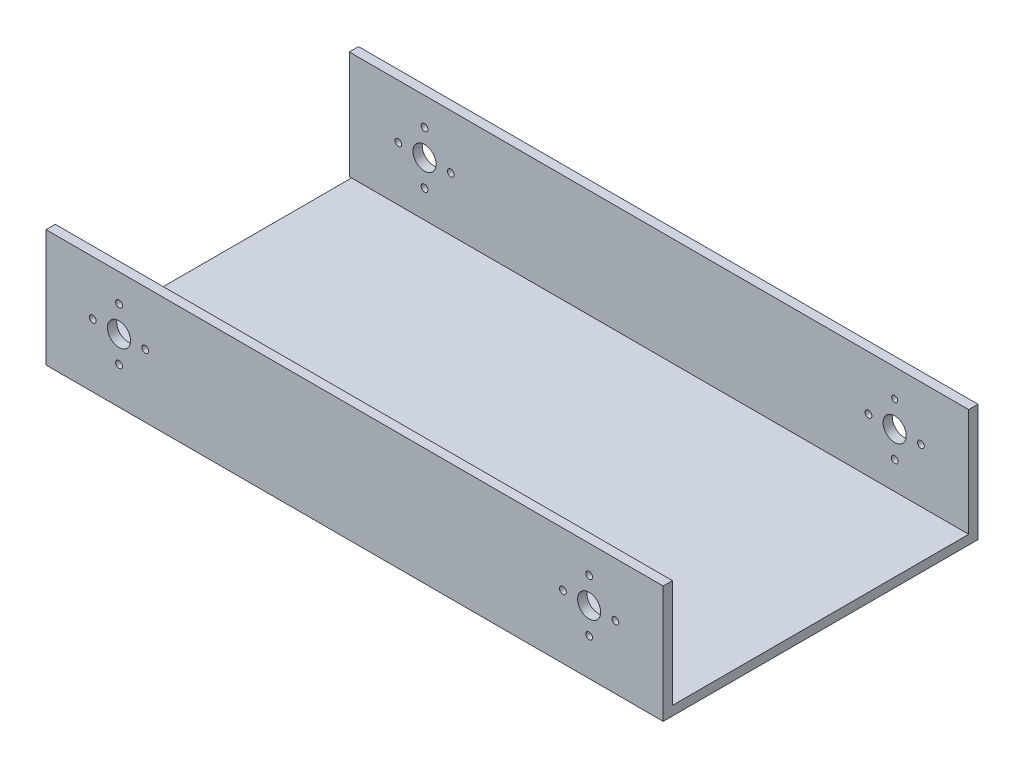
from build123d import *

# Parameters (mm, degrees)
SKETCH_1_W          = 200
SKETCH_1_H          = 35
EXTRUDE_1_DEPTH     = 3
SKETCH_2_R          = 3.75
CUT_EXTRUDE_1_DEPTH = 3
SKETCH_3_R          = 1.1
CUT_EXTRUDE_2_DEPTH = 3
SKETCH_4_W          = 200
SKETCH_4_H          = 102
EXTRUDE_2_DEPTH     = 3
SKETCH_5_W          = 200.720856775
SKETCH_5_H          = 3
EXTRUDE_3_DEPTH     = 35
CUT_EXTRUDE_START   = -35
SKETCH_6_R          = 3.75
SKETCH_6_R_2        = 1.1
SKETCH_6_R_3        = 0.981653735
CUT_EXTRUDE_3_DEPTH = 35


with BuildPart() as part:
    # 스케치1 → 보스-돌출1 (new body)
    with BuildSketch(Plane.XY):
        Rectangle(SKETCH_1_W, SKETCH_1_H)
    extrude(amount=EXTRUDE_1_DEPTH)

    # 스케치2 → 컷-돌출1 (cut)
    with BuildSketch(Plane.XY.offset(3)):
        with Locations((-76.33997629, 0)):
            Circle(SKETCH_2_R)
        with Locations((76, 0)):
            Circle(SKETCH_2_R)
    extrude(amount=-CUT_EXTRUDE_1_DEPTH, mode=Mode.SUBTRACT)

    # 스케치3 → 컷-돌출2 (cut)
    with BuildSketch(Plane.XY.offset(3)):
        with Locations((-76.33997629, 8.5)):
            Circle(SKETCH_3_R)
        with Locations((-76.33997629, -8.5)):
            Circle(SKETCH_3_R)
        with Locations((-84.83997629, 0)):
            Circle(SKETCH_3_R)
        with Locations((-67.83997629, 0)):
            Circle(SKETCH_3_R)
        with Locations((76, 8.5)):
            Circle(SKETCH_3_R)
        with Locations((76, -8.5)):
            Circle(SKETCH_3_R)
        with Locations((67.5, 0)):
            Circle(SKETCH_3_R)
        with Locations((84.5, 0)):
            Circle(SKETCH_3_R)
    extrude(amount=-CUT_EXTRUDE_2_DEPTH, mode=Mode.SUBTRACT)

    # 스케치4 → 보스-돌출2 (add)
    with BuildSketch(Plane.XZ.offset(17.5)):
        with Locations((0, -48)):
            Rectangle(SKETCH_4_W, SKETCH_4_H)
    extrude(amount=EXTRUDE_2_DEPTH)

    # 스케치5 → 보스-돌출3 (add)
    with BuildSketch(Plane(origin=(0, -17.5, 0), x_dir=(1, 0, 0), z_dir=(0, 1, 0))):
        with Locations((-0.360428388, 97.5)):
            Rectangle(SKETCH_5_W, SKETCH_5_H)
    extrude(amount=EXTRUDE_3_DEPTH)

    # 스케치6 → 컷-돌출3 (cut)
    with BuildSketch(Plane(origin=(0, 0, -99), x_dir=(-1, 0, 0), z_dir=(0, 0, -1)).offset(CUT_EXTRUDE_START)):
        with Locations((-76, 0)):
            Circle(SKETCH_6_R)
        with Locations((76.33997629, 0)):
            Circle(SKETCH_6_R)
        with Locations((-76, -8.5)):
            Circle(SKETCH_6_R_2)
        with Locations((-67.5, 0)):
            Circle(SKETCH_6_R_2)
        with Locations((-76, 8.5)):
            Circle(SKETCH_6_R_3)
        with Locations((-84.5, 0)):
            Circle(SKETCH_6_R_2)
        with Locations((84.83997629, 0)):
            Circle(SKETCH_6_R_2)
        with Locations((76.33997629, 8.5)):
            Circle(SKETCH_6_R_2)
        with Locations((67.83997629, 0)):
            Circle(SKETCH_6_R_2)
        with Locations((76.33997629, -8.5)):
            Circle(SKETCH_6_R_2)
    extrude(amount=CUT_EXTRUDE_3_DEPTH, mode=Mode.SUBTRACT)


solid = part.part
